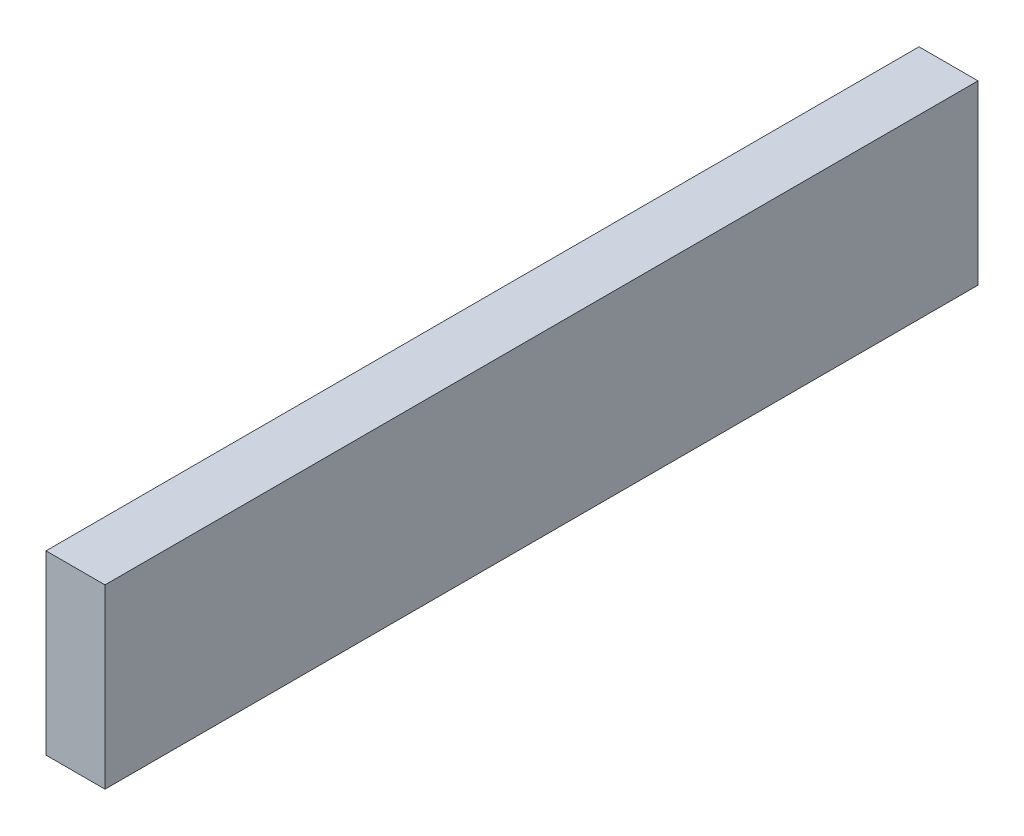
from build123d import *

# Parameters (mm, degrees)
SKETCH1_W            = 15
SKETCH1_H            = 20
BOSS_EXTRUDE1_DEPTH  = 230
SKETCH2_W            = 65
SKETCH2_H            = 40
BOSS_EXTRUDE6_DEPTH  = 5
SKETCH7_W            = 75
SKETCH7_H            = 15
BOSS_EXTRUDE7_DEPTH  = 5
SKETCH8_W            = 74
SKETCH8_H            = 15
BOSS_EXTRUDE8_DEPTH  = 5
SKETCH9_W            = 65
SKETCH9_H            = 40
BOSS_EXTRUDE11_DEPTH = 5
CUT_EXTRUDE1_DEPTH   = 240.635139326


with BuildPart() as part:
    # Sketch1 → Boss-Extrude1 (new body)
    with BuildSketch(Plane.XY):
        Rectangle(SKETCH1_W, SKETCH1_H)
    extrude(amount=BOSS_EXTRUDE1_DEPTH)

    # Sketch10 → Cut-Extrude1 (cut, through all)
    with BuildSketch(Plane.ZY.offset(7.5)):
        with BuildLine():
            Line((209.843145751, 2), (211.343145751, 2))
            ThreePointArc((211.343145751, 2), (223, 0), (211.343145751, -2))
            Line((211.343145751, -2), (209.843145751, -2))
            Line((209.843145751, -2), (209.843145751, 2))
        make_face()
    extrude(amount=-CUT_EXTRUDE1_DEPTH, mode=Mode.SUBTRACT)


with BuildPart() as body_2:
    # Sketch2 → Boss-Extrude6 (new body)
    with BuildSketch(Plane(origin=(0, 0, 0), x_dir=(-1, 0, 0), z_dir=(0, 0, -1))):
        with Locations((0, 30)):
            Rectangle(SKETCH2_W, SKETCH2_H)
    extrude(amount=-BOSS_EXTRUDE6_DEPTH)


with BuildPart() as body_3:
    # Sketch7 → Boss-Extrude7 (new body)
    with BuildSketch(Plane(origin=(32.5, 0, 0), x_dir=(0, 0, -1), z_dir=(1, 0, 0))):
        with Locations((-37.5, 30)):
            Rectangle(SKETCH7_W, SKETCH7_H)
    extrude(amount=BOSS_EXTRUDE7_DEPTH)


with BuildPart() as body_4:
    # Sketch8 → Boss-Extrude8 (new body)
    with BuildSketch(Plane.ZY.offset(32.5)):
        with Locations((37, 30)):
            Rectangle(SKETCH8_W, SKETCH8_H)
    extrude(amount=BOSS_EXTRUDE8_DEPTH)


with BuildPart() as body_5:
    # Sketch9 → Boss-Extrude11 (new body)
    with BuildSketch(Plane.XY.offset(74)):
        with Locations((0, 30)):
            Rectangle(SKETCH9_W, SKETCH9_H)
    extrude(amount=-BOSS_EXTRUDE11_DEPTH)


solid = body_4.part
